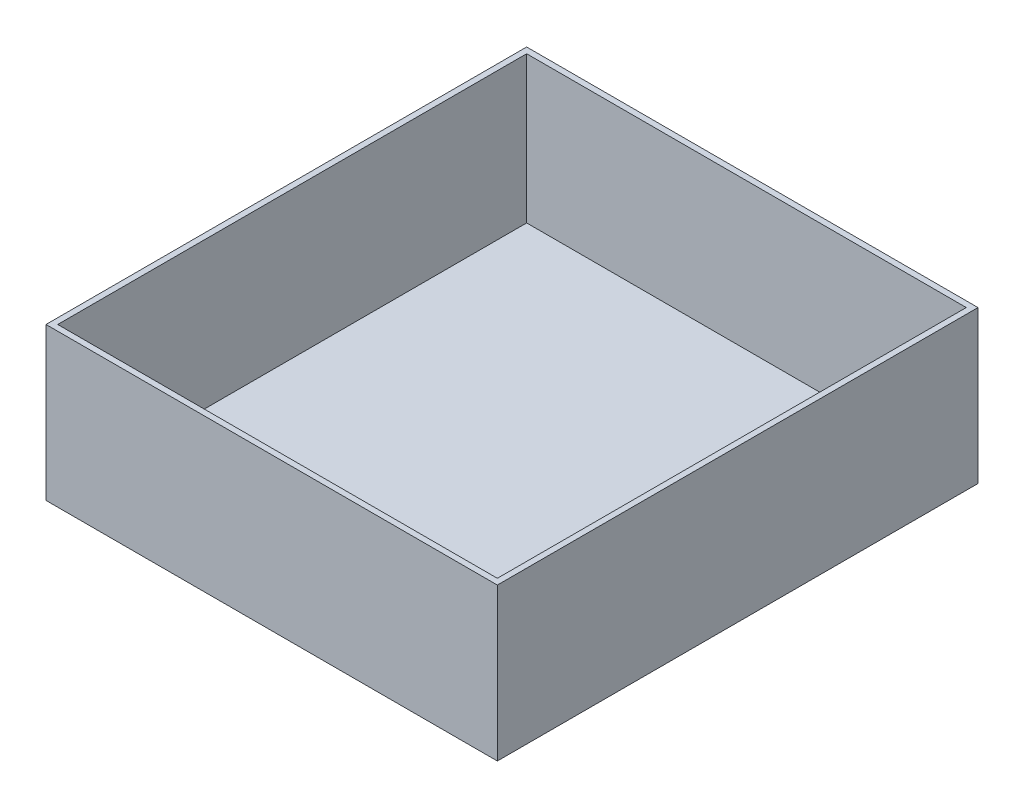
from build123d import *

# Parameters (mm, degrees)
SKETCH2_W   = 154
SKETCH2_H   = 164
SKETCH2_W_2 = 150
SKETCH2_H_2 = 160
WALLS_DEPTH = 50
SKETCH3_W   = 154
SKETCH3_H   = 164
BASE_DEPTH  = 2


with BuildPart() as part:
    # Sketch2 → Walls (new body)
    with BuildSketch(Plane(origin=(0, 0, 0), x_dir=(1, 0, 0), z_dir=(0, 1, 0))):
        Rectangle(SKETCH2_W, SKETCH2_H)
        Rectangle(SKETCH2_W_2, SKETCH2_H_2, mode=Mode.SUBTRACT)
    extrude(amount=WALLS_DEPTH)

    # Sketch3 → Base (add)
    with BuildSketch(Plane.XZ):
        Rectangle(SKETCH3_W, SKETCH3_H)
    extrude(amount=BASE_DEPTH)


solid = part.part
